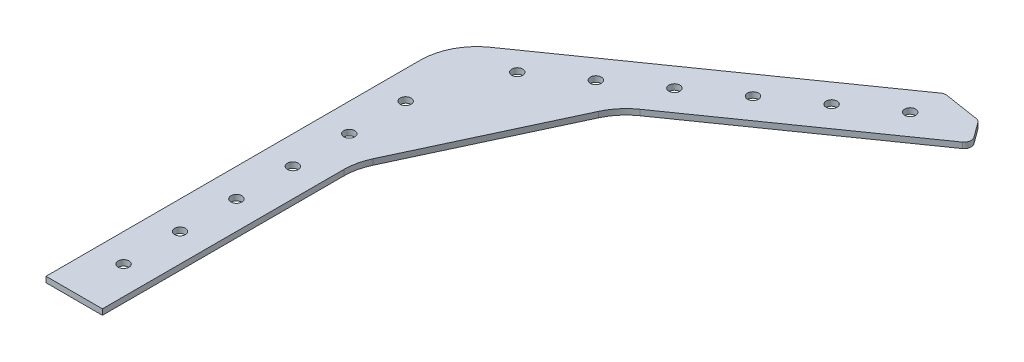
from build123d import *

# Parameters (mm, degrees)
BOSS_EXTRUDE1_DEPTH              = 1.27
F_10_0_1935_DIAMETER_HOLE2_D     = 4.9149
F_10_0_1935_DIAMETER_HOLE2_DEPTH = 50.8
F_10_0_1935_DIAMETER_HOLE2_TIP   = 1.476584928
FILLET1_R                        = 25.4
CHAMFER1_SIZE                    = 12.7
CHAMFER1_SIZE2                   = 12.953753206
FILLET3_R                        = 3.175


with BuildPart() as part:
    # Sketch1 → Boss-Extrude1 (new, symmetric)
    with BuildSketch(Plane(origin=(0, 0, 0), x_dir=(1, 0, 0), z_dir=(0, 1, 0))):
        Polygon((-49.1324746, -114.072394731), (-23.7324746, -114.072394731), (-23.7324746, 0.227605269), (13.838288869, 80.798367536), (107.467367531, 146.358154211), (92.497603039, 166.878050679), (-49.1324746, 67.707602679), align=None)
    extrude(amount=BOSS_EXTRUDE1_DEPTH, both=True)

    # #10 (0.1935) Diameter Hole2
    with Locations(Plane(origin=(0, 1.27, 0), x_dir=(1, 0, 0), z_dir=(0, 1, 0))):
        with Locations((81.413587814, 144.4055404), (60.607125889, 129.836698916), (39.800663964, 115.267857433), (18.994202039, 100.69901595), (-1.812259886, 86.130174466), (-22.618721811, 71.561332983), (-36.4324746, 35.152605269), (-36.4324746, 9.752605269), (-36.4324746, -15.647394731), (-36.4324746, -41.047394731), (-36.4324746, -66.447394731), (-36.4324746, -91.847394731)):
            Hole(F_10_0_1935_DIAMETER_HOLE2_D / 2, depth=F_10_0_1935_DIAMETER_HOLE2_DEPTH)
            with Locations((0, 0, -(F_10_0_1935_DIAMETER_HOLE2_DEPTH + F_10_0_1935_DIAMETER_HOLE2_TIP / 2))):  # 118° drill point
                Cone(0, F_10_0_1935_DIAMETER_HOLE2_D / 2, F_10_0_1935_DIAMETER_HOLE2_TIP, mode=Mode.SUBTRACT)

    # Fillet1
    fillet1_edges = [part.edges().sort_by_distance(p)[0] for p in [
        (-49.1324746, 0, -67.707602679),
        (13.838288869, 0, -80.798367536),
        (-23.7324746, 0, -0.227605269),
    ]]
    fillet(fillet1_edges, radius=FILLET1_R)

    # Chamfer1
    chamfer1_edges = [part.edges().sort_by_distance(p)[0] for p in [
        (92.497603039, 0, -166.878050679),
    ]]
    chamfer1_side = [part.faces().sort_by_distance(p)[0] for p in [
        (99.982485285, 0, -156.618102445),
    ]]
    chamfer(chamfer1_edges, length=CHAMFER1_SIZE, length2=CHAMFER1_SIZE2, reference=chamfer1_side[0])

    # Fillet3
    fillet3_edges = [part.edges().sort_by_distance(p)[0] for p in [
        (107.467367531, 0, -146.358154211),
        (99.982485285, 0, -156.618102445),
        (81.886509619, 0, -159.448083078),
    ]]
    fillet(fillet3_edges, radius=FILLET3_R)


solid = part.part
